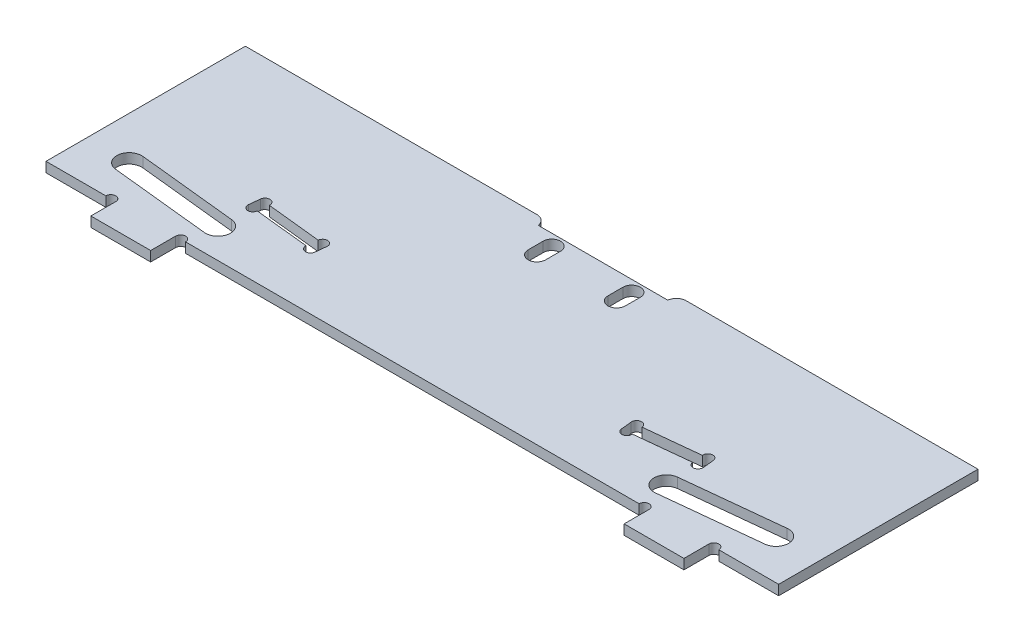
from build123d import *

# Parameters (mm, degrees)
SKETCH_1_W          = 147
SKETCH_1_H          = 40
EXTRUDE_1_DEPTH     = 2
CUT_EXTRUDE_1_DEPTH = 77.198753271
SKETCH_3_R          = 1
CUT_EXTRUDE_2_DEPTH = 77.198753271
SKETCH_5_W          = 12
SKETCH_5_H          = 2
EXTRUDE_2_DEPTH     = 5
SKETCH_7_R          = 1
CUT_EXTRUDE_3_DEPTH = 78.661122835
CUT_EXTRUDE_5_DEPTH = 78.661122835
SKETCH_11_W         = 26
SKETCH_11_H         = 3.5
CUT_EXTRUDE_6_DEPTH = 10
FILLET_1_R          = 2
CUT_EXTRUDE_7_DEPTH = 78.661122835


with BuildPart() as part:
    # 草图1 → 凸台-拉伸1 (new body)
    with BuildSketch(Plane(origin=(0, 0, 0), x_dir=(1, 0, 0), z_dir=(0, 1, 0))):
        Rectangle(SKETCH_1_W, SKETCH_1_H)
    extrude(amount=EXTRUDE_1_DEPTH)

    # 草图2 → 切除-拉伸1 (cut, through all)
    with BuildSketch(Plane(origin=(0, 2, 0), x_dir=(1, 0, 0), z_dir=(0, 1, 0))):
        Polygon((-45.658720859, -7.223049229), (-45.42875824, -5.035101059), (-30.51092981, -6.603028008), (-30.740892429, -8.790976178), align=None)
    cut_extrude_1 = extrude(amount=-CUT_EXTRUDE_1_DEPTH, mode=Mode.SUBTRACT)

    # 草图3 → 切除-拉伸2 (cut, through all)
    with BuildSketch(Plane(origin=(0, 2, 0), x_dir=(1, 0, 0), z_dir=(0, 1, 0))):
        with Locations((-44.434236345, -5.139629522)):
            Circle(SKETCH_3_R)
        with Locations((-44.664198964, -7.327577692)):
            Circle(SKETCH_3_R)
        with Locations((-31.505451705, -6.498499545)):
            Circle(SKETCH_3_R)
        with Locations((-31.735414324, -8.686447714)):
            Circle(SKETCH_3_R)
    cut_extrude_2 = extrude(amount=-CUT_EXTRUDE_2_DEPTH, mode=Mode.SUBTRACT)

    # 镜向1: 切除-拉伸1, 切除-拉伸2 across plane
    add(cut_extrude_1.mirror(Plane(origin=(0, 0, 0), x_dir=(0, 0, 1), z_dir=(1, 0, 0))), mode=Mode.SUBTRACT)
    add(cut_extrude_2.mirror(Plane(origin=(0, 0, 0), x_dir=(0, 0, 1), z_dir=(1, 0, 0))), mode=Mode.SUBTRACT)

    # 草图5 → 凸台-拉伸2 (add)
    with BuildSketch(Plane.XY.offset(20)):
        with Locations((53.5, 1)):
            Rectangle(SKETCH_5_W, SKETCH_5_H)
        with Locations((-53.5, 1)):
            Rectangle(SKETCH_5_W, SKETCH_5_H)
    extrude(amount=EXTRUDE_2_DEPTH)

    # 草图7 → 切除-拉伸3 (cut, through all)
    with BuildSketch(Plane(origin=(0, 2, 0), x_dir=(1, 0, 0), z_dir=(0, 1, 0))):
        with Locations((60.5, -20)):
            Circle(SKETCH_7_R)
        with Locations((46.5, -20)):
            Circle(SKETCH_7_R)
        with Locations((-46.5, -20)):
            Circle(SKETCH_7_R)
        with Locations((-60.5, -20)):
            Circle(SKETCH_7_R)
    extrude(amount=-CUT_EXTRUDE_3_DEPTH, mode=Mode.SUBTRACT)

    # 草图10 → 切除-拉伸5 (cut, through all)
    with BuildSketch(Plane(origin=(0, 2, 0), x_dir=(1, 0, 0), z_dir=(0, 1, 0))):
        with BuildLine():
            Line((-64.629116749, -9.423125996), (-44.738678842, -11.513695262))
            ThreePointArc((-44.738678842, -11.513695262), (-42.513695262, -14.261321158), (-45.261321158, -16.486304738))
            Line((-45.261321158, -16.486304738), (-65.151759066, -14.395735473))
            ThreePointArc((-65.151759066, -14.395735473), (-67.376742646, -11.648109576), (-64.629116749, -9.423125996))
        make_face()
    cut_extrude_5 = extrude(amount=-CUT_EXTRUDE_5_DEPTH, mode=Mode.SUBTRACT)

    # 镜向2: 切除-拉伸5 across plane
    add(cut_extrude_5.mirror(Plane(origin=(0, 0, 0), x_dir=(0, 0, 1), z_dir=(1, 0, 0))), mode=Mode.SUBTRACT)

    # 草图11 → 切除-拉伸6 (cut)
    with BuildSketch(Plane(origin=(0, 2, 0), x_dir=(1, 0, 0), z_dir=(0, 1, 0))):
        with Locations((0, 20)):
            Rectangle(SKETCH_11_W, SKETCH_11_H)
    extrude(amount=-CUT_EXTRUDE_6_DEPTH, mode=Mode.SUBTRACT)

    # 圆角1
    # the kernel refuses this fillet: 2 mm, written as the material it takes off along each edge
    with BuildSketch(Plane(origin=(13, -4.960783708, -20), x_dir=(1, 0, 0), z_dir=(0, 1, 0)), Plane(origin=(-13, 6.960783708, -20), x_dir=(-1, 0, 0), z_dir=(0, -1, 0))) as fillet_1_piece_1:
        with BuildLine():
            CenterArc((1.984313483, -2), FILLET_1_R, 90, 82.819244219)
            Line((0, -1.75), (-0.03968627, -1.745))
            ThreePointArc((-0.03968627, -1.745), (-0.04, -0.875), (-0.04, 0))
            Line((-0.04, 0), (0, 0.04))
            Line((0, 0.04), (1.984313483, 0.04))
            Line((1.984313483, 0.04), (1.984313483, 0))
        make_face()
    extrude(amount=11.921567416, mode=Mode.SUBTRACT)

    # 草图12 → 切除-拉伸7 (cut, through all)
    with BuildSketch(Plane(origin=(0, 2, 0), x_dir=(1, 0, 0), z_dir=(0, 1, 0))):
        with BuildLine():
            Line((-6.25, 16), (-6.25, 13))
            ThreePointArc((-6.25, 13), (-8, 11.25), (-9.75, 13))
            Line((-9.75, 13), (-9.75, 16))
            ThreePointArc((-9.75, 16), (-8, 17.75), (-6.25, 16))
        make_face()
        with BuildLine():
            Line((9.75, 16), (9.75, 13))
            ThreePointArc((9.75, 13), (8, 11.25), (6.25, 13))
            Line((6.25, 13), (6.25, 16))
            ThreePointArc((6.25, 16), (8, 17.75), (9.75, 16))
        make_face()
    extrude(amount=-CUT_EXTRUDE_7_DEPTH, mode=Mode.SUBTRACT)


solid = part.part
